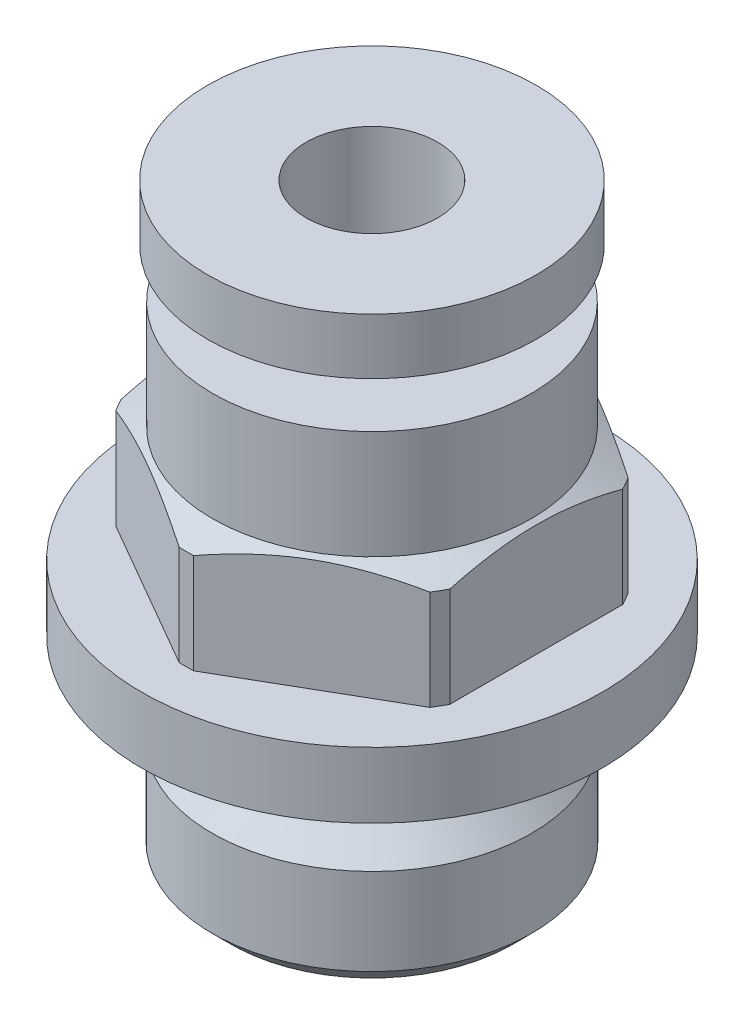
from build123d import *

# Parameters (mm, degrees)
ESTRUSIONE_ESTRUSIONE1_START                         = 8
ESTRUSIONE_ESTRUSIONE1_2_OUTLINE_R                   = 4.864
ESTRUSIONE_ESTRUSIONE1_2_DEPTH                       = 3.491917096
SCHIZZO2_R                                           = 4.85
ESTRUSIONE_ESTRUSIONE2_DEPTH                         = 3.3
SCHIZZO3_R                                           = 2.55
ESTRUSIONE_ESTRUSIONE3_DEPTH                         = 1.5
SCHIZZO4_R                                           = 5
ESTRUSIONE_ESTRUSIONE4_DEPTH                         = 1.7
FORO_LAMATO_PER_VITE_M2_5_A_TESTA_ESAGON_D           = 3.1
FORO_LAMATO_PER_VITE_M2_5_A_TESTA_ESAGON_CBORE_D     = 4
FORO_LAMATO_PER_VITE_M2_5_A_TESTA_ESAGON_CBORE_DEPTH = 10
SMUSSO1_SIZE                                         = 0.581


with BuildPart() as part:
    # Estrusione-Estrusione1: read off the stored shape, not the designer's step
    # Estrusione-Estrusione1 outline → Estrusione-Estrusione1 (revolve)
    with BuildSketch(Plane.XY):
        with BuildLine():
            Line((0, 0), (4.864, 0))
            Line((4.864, 0), (4.864, 3.219))
            Line((4.864, 3.219), (4.1, 3.983))
            Line((4.1, 3.983), (4.1, 6))
            ThreePointArc((4.1, 6), (4.99, 5.11), (5.88, 6))
            Line((5.88, 6), (7, 6))
            Line((7, 6), (7, 8))
            Line((7, 8), (4.864, 8))
            Line((4.864, 8), (4.864, 11.491917096))
            Line((4.864, 11.491917096), (4.85, 11.5))
            Line((4.85, 11.5), (0, 11.5))
            Line((0, 11.5), (0, 0))
        make_face()
    revolve(axis=Axis((0, 0, 0), (0, 1, 0)))

    # Estrusione-Estrusione1 2 outline → Estrusione-Estrusione1 2 (add)
    with BuildSketch(Plane(origin=(0, 0, 0), x_dir=(1, 0, 0), z_dir=(0, 1, 0)).offset(ESTRUSIONE_ESTRUSIONE1_START)):
        with BuildLine():
            ThreePointArc((4.77856863, -3.014594807), (4.893043531, -2.825), (5, -2.631064423))
            Line((5, -2.631064423), (5, 2.631064423))
            ThreePointArc((5, 2.631064423), (4.893043531, 2.825), (4.77856863, 3.014594807))
            Line((4.77856863, 3.014594807), (0.22143137, 5.645659231))
            ThreePointArc((0.22143137, 5.645659231), (0, 5.65), (-0.22143137, 5.645659231))
            Line((-0.22143137, 5.645659231), (-4.77856863, 3.014594807))
            ThreePointArc((-4.77856863, 3.014594807), (-4.893043531, 2.825), (-5, 2.631064423))
            Line((-5, 2.631064423), (-5, -2.631064423))
            ThreePointArc((-5, -2.631064423), (-4.893043531, -2.825), (-4.77856863, -3.014594807))
            Line((-4.77856863, -3.014594807), (-0.22143137, -5.645659231))
            ThreePointArc((-0.22143137, -5.645659231), (0, -5.65), (0.22143137, -5.645659231))
            Line((0.22143137, -5.645659231), (4.77856863, -3.014594807))
        make_face()
        Circle(ESTRUSIONE_ESTRUSIONE1_2_OUTLINE_R, mode=Mode.SUBTRACT)
    extrude(amount=ESTRUSIONE_ESTRUSIONE1_2_DEPTH)

    # Estrusione-Estrusione1 3 outline → Estrusione-Estrusione1 3 (revolve, cut)
    with BuildSketch(Plane.XY):
        Polygon((5.65, 11.491917096), (4.864, 11.491917096), (5.65, 11.038119785), align=None)
    revolve(axis=Axis((0, 0, 0), (0, 1, 0)), mode=Mode.SUBTRACT)

    # Schizzo2 → Estrusione-Estrusione2 (add)
    with BuildSketch(Plane(origin=(0, 11.5, 0), x_dir=(-1, 0, 0), z_dir=(0, 1, 0))):
        with Locations(Location((0, 0, 0), (0, 0, 90))):
            Circle(SCHIZZO2_R)
    extrude(amount=ESTRUSIONE_ESTRUSIONE2_DEPTH)

    # Schizzo3 → Estrusione-Estrusione3 (add)
    with BuildSketch(Plane(origin=(0, 14.8, 0), x_dir=(-1, 0, 0), z_dir=(0, 1, 0))):
        with Locations(Location((0, 0, 0), (0, 0, 270))):
            Circle(SCHIZZO3_R)
    extrude(amount=ESTRUSIONE_ESTRUSIONE3_DEPTH)

    # Schizzo4 → Estrusione-Estrusione4 (add)
    with BuildSketch(Plane.XZ.offset(-16.3)):
        with Locations(Location((0, 0, 0), (0, 0, 90))):
            Circle(SCHIZZO4_R)
    extrude(amount=-ESTRUSIONE_ESTRUSIONE4_DEPTH)

    # Foro lamato per Vite M2.5 a testa esagonale-1 (through all)
    with Locations(Plane(origin=(0, 18, 0), x_dir=(1, 0, 0), z_dir=(0, 1, 0))):
        with Locations((0, 0)):
            CounterBoreHole(FORO_LAMATO_PER_VITE_M2_5_A_TESTA_ESAGON_D / 2, FORO_LAMATO_PER_VITE_M2_5_A_TESTA_ESAGON_CBORE_D / 2, FORO_LAMATO_PER_VITE_M2_5_A_TESTA_ESAGON_CBORE_DEPTH)

    # Smusso1
    smusso1_edges = [part.edges().sort_by_distance(p)[0] for p in [
        (-4.864, 0, 0),
    ]]
    chamfer(smusso1_edges, length=SMUSSO1_SIZE)


solid = part.part
